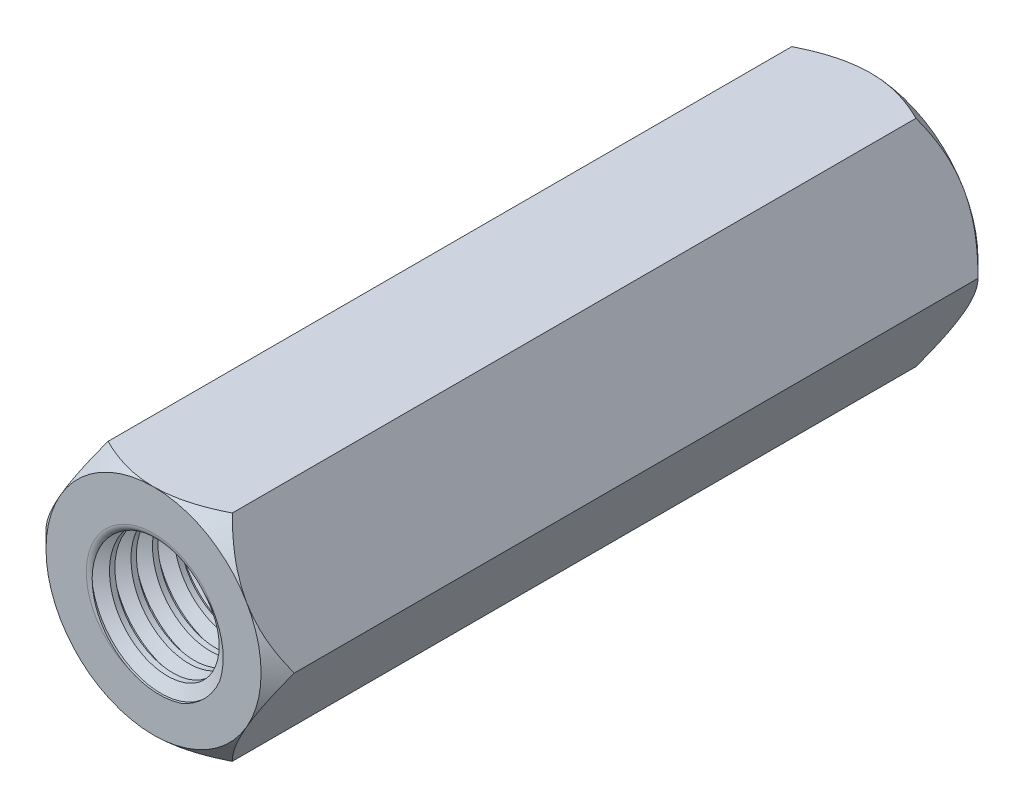
from build123d import *

# Parameters (mm, degrees)
BOSS_EXTRUDE1_DEPTH     = 25
SKETCH3_OUTSIDE_W       = 134.912
SKETCH3_OUTSIDE_H       = 132.592
SKETCH3_OUTSIDE_R       = 7.5
CUT_EXTRUDE1_DEPTH      = 52.295711322
CUT_EXTRUDE1_DRAFT      = -45
MIRROR1_COPY_1_SKETCH_W = 134.912
MIRROR1_COPY_1_SKETCH_H = 132.592
MIRROR1_COPY_1_SKETCH_R = 7.5
MIRROR1_COPY_1_DEPTH    = 52.295711322
MIRROR1_COPY_1_DRAFT    = -45
SKETCH4_R               = 4.19
CUT_EXTRUDE2_DEPTH      = 52.295711322
FILLET2_R               = 0.5
THREAD1_PITCH           = 1.5


with BuildPart() as part:
    # Sketch1 → Boss-Extrude1 (new, symmetric)
    with BuildSketch(Plane.XY):
        Polygon((8.660254038, 0), (4.330127019, 7.5), (-4.330127019, 7.5), (-8.660254038, 0), (-4.330127019, -7.5), (4.330127019, -7.5), align=None)
    extrude(amount=BOSS_EXTRUDE1_DEPTH, both=True)


with BuildPart() as cut_extrude1_tool:
    # Sketch3 outside → Cut-Extrude1 (with draft: the straight prism first)
    with BuildSketch(Plane.XY.offset(25)):
        Rectangle(SKETCH3_OUTSIDE_W, SKETCH3_OUTSIDE_H)
        Circle(SKETCH3_OUTSIDE_R, mode=Mode.SUBTRACT)
    extrude(amount=-CUT_EXTRUDE1_DEPTH)
    # Cut-Extrude1: the draft: its side faces are tilted about the plane it starts from
    cut_extrude1_sides = [cut_extrude1_tool.faces().sort_by_distance(p)[0] for p in [
        (0, -66.296, -1.147855661),
        (67.456, 0, -1.147855661),
        (0, 66.296, -1.147855661),
        (-67.456, 0, -1.147855661),
        (-7.5, 0, -1.147855661),
    ]]
    draft(cut_extrude1_sides, Plane.XY.offset(25), CUT_EXTRUDE1_DRAFT)


with BuildPart() as part_1:
    add(part.part)

    # Cut-Extrude1: cut by cut_extrude1_tool
    add(cut_extrude1_tool.part, mode=Mode.SUBTRACT)


with BuildPart() as mirror1_copy_1_tool:
    # Mirror1 copy 1 sketch → Mirror1 copy 1 (with draft: the straight prism first)
    with BuildSketch(Plane(origin=(0, 0, -25), x_dir=(1, 0, 0), z_dir=(0, 0, -1))):
        Rectangle(MIRROR1_COPY_1_SKETCH_W, MIRROR1_COPY_1_SKETCH_H)
        Circle(MIRROR1_COPY_1_SKETCH_R, mode=Mode.SUBTRACT)
    extrude(amount=-MIRROR1_COPY_1_DEPTH)
    # Mirror1 copy 1: the draft: its side faces are tilted about the plane it starts from
    mirror1_copy_1_sides = [mirror1_copy_1_tool.faces().sort_by_distance(p)[0] for p in [
        (0, -66.296, 1.147855661),
        (67.456, 0, 1.147855661),
        (0, 66.296, 1.147855661),
        (-67.456, 0, 1.147855661),
        (-7.5, 0, 1.147855661),
    ]]
    draft(mirror1_copy_1_sides, Plane(origin=(0, 0, -25), x_dir=(1, 0, 0), z_dir=(0, 0, -1)), MIRROR1_COPY_1_DRAFT)


with BuildPart() as part_2:
    add(part_1.part)

    # Mirror1 copy 1: cut by mirror1_copy_1_tool
    add(mirror1_copy_1_tool.part, mode=Mode.SUBTRACT)

    # Sketch4 → Cut-Extrude2 (cut, through all)
    with BuildSketch(Plane.XY.offset(25)):
        Circle(SKETCH4_R)
    extrude(amount=-CUT_EXTRUDE2_DEPTH, mode=Mode.SUBTRACT)

    # Fillet2
    fillet2_edges = [part_2.edges().sort_by_distance(p)[0] for p in [
        (-4.19, 0, -25),
        (-4.19, 0, 25),
    ]]
    fillet(fillet2_edges, radius=FILLET2_R)

    # Thread1: arcs per turn and ends read off the stored shape
    # Thread1: the profile of Thread Profile1 profile screwed along a right-hand helix through 35.333331 turns, 8 arcs to a turn; built about Z, then put on its axis
    thread1_z = Axis((0, 0, 0), (0, 0, 1))
    thread1_corners = [(4.1897, 0, -0.000173205), (5.001898813, 0, 0.468749998), (5.001898813, 0, 0.656249998), (4.1897, 0, 1.125173201)]
    with BuildLine(mode=Mode.PRIVATE) as thread1_profile:
        Line(thread1_corners[0], thread1_corners[1])
        Line(thread1_corners[1], thread1_corners[2])
        Line(thread1_corners[2], thread1_corners[3])
        Line(thread1_corners[3], thread1_corners[0])
    thread1_cap = Face(thread1_profile.wire())
    thread1_turn_angles = [0, 22.5, 45, 67.5, 90, 112.5, 135, 157.5, 180, 202.5, 225, 247.5, 270, 292.5, 315, 337.5, 360]
    thread1_turn_weights = [1, 0.9238795325112867, 1, 0.9238795325112867, 1, 0.9238795325112867, 1, 0.9238795325112867, 1, 0.9238795325112867, 1, 0.9238795325112867, 1, 0.9238795325112867, 1, 0.9238795325112867, 1]
    thread1_turn_rails = [Edge.make_bspline([Vector(p[0], p[1], 0).rotate(thread1_z, thread1_turn_angles[k]) / thread1_turn_weights[k] + Vector(0, 0, p[2] + THREAD1_PITCH * thread1_turn_angles[k] / 360) for k in range(17)], [0, 0, 0, 1, 1, 2, 2, 3, 3, 4, 4, 5, 5, 6, 6, 7, 7, 8, 8, 8], 2, thread1_turn_weights) for p in thread1_corners]
    thread1_turn_sides = [Face.make_surface_from_curves(thread1_turn_rails[p[0]], thread1_turn_rails[p[1]]) for p in [(0, 1), (1, 2), (2, 3), (3, 0)]]
    thread1_last_angles = [12600, 12622.5, 12645, 12667.5, 12690, 12704.9995, 12719.999]
    thread1_last_weights = [1, 0.9238795325112867, 1, 0.9238795325112867, 1, 0.965928084874541, 1]
    thread1_last_rails = [Edge.make_bspline([Vector(p[0], p[1], 0).rotate(thread1_z, thread1_last_angles[k]) / thread1_last_weights[k] + Vector(0, 0, p[2] + THREAD1_PITCH * thread1_last_angles[k] / 360) for k in range(7)], [0, 0, 0, 1, 1, 2, 2, 3, 3, 3], 2, thread1_last_weights) for p in thread1_corners]
    thread1_last_sides = [Face.make_surface_from_curves(thread1_last_rails[p[0]], thread1_last_rails[p[1]]) for p in [(0, 1), (1, 2), (2, 3), (3, 0)]]
    thread1 = Plane(origin=(0, 0, 26.5), x_dir=(-1, 0, 0), z_dir=(0, 0, -1)) * Solid(Shell([*[p.moved(Location((0, 0, THREAD1_PITCH * i))) for i in range(35) for p in thread1_turn_sides], *thread1_last_sides, thread1_cap, thread1_cap.rotate(thread1_z, 12719.999).moved(Location((0, 0, THREAD1_PITCH * 12719.999 / 360)))]))
    add(thread1, mode=Mode.SUBTRACT)


solid = part_2.part
